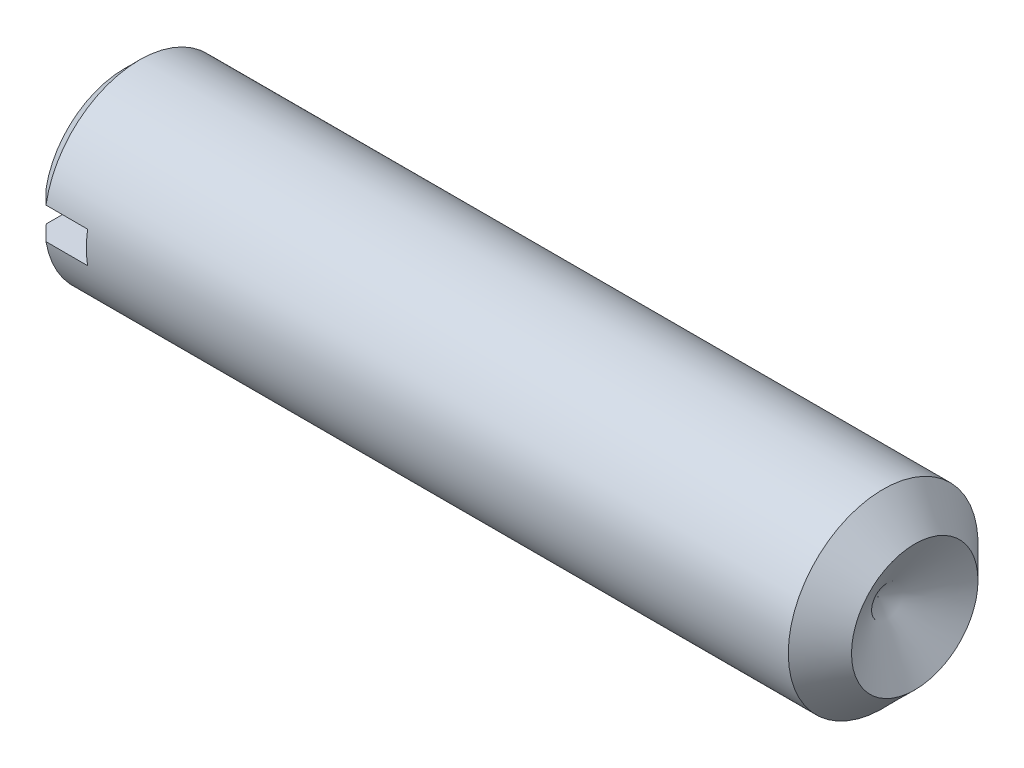
from build123d import *

# Parameters (mm, degrees)
SLOTSKE_W  = 12
SLOTSKE_H  = 2
SLOT_DEPTH = 3.6


with BuildPart() as part:
    # BodySke → BaseBody (revolve)
    with BuildSketch(Plane.XY):
        Polygon((0, 0), (0, 5.036), (0.964, 6), (48, 6), (50, 4), (47.690598923, 0), align=None)
    revolve(axis=Axis((0, 0, 0), (1, 0, 0)))

    # SlotSke → Slot (cut)
    with BuildSketch(Plane(origin=(0, 0, 0), x_dir=(0, 0, -1), z_dir=(1, 0, 0))):
        Rectangle(SLOTSKE_W, SLOTSKE_H)
    extrude(amount=SLOT_DEPTH, mode=Mode.SUBTRACT)


solid = part.part
